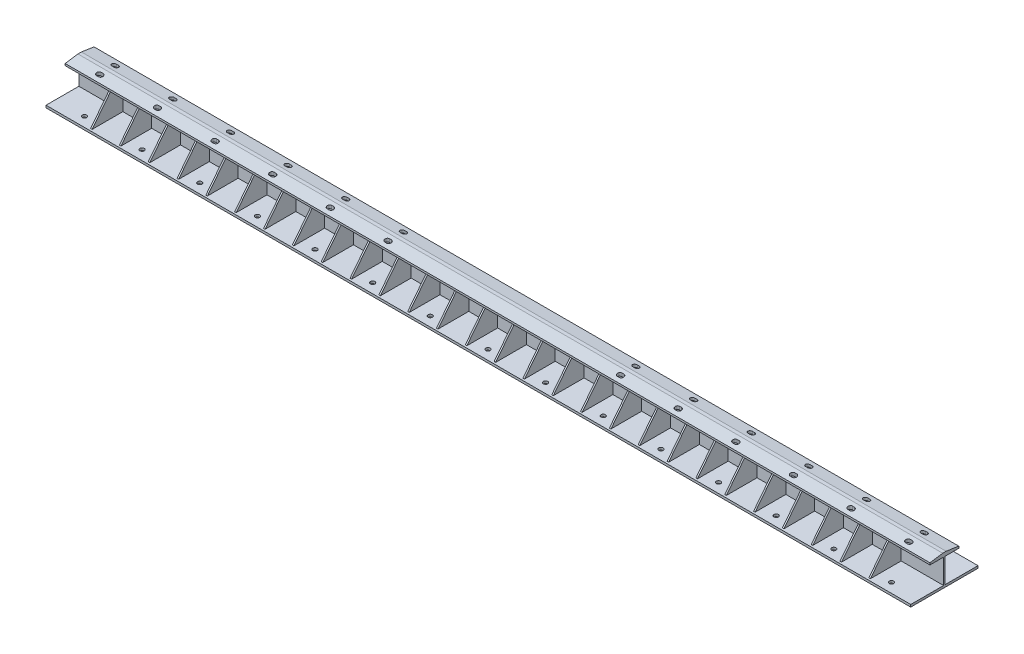
from build123d import *

# Parameters (mm, degrees)
SKETCH_1_W            = 4500
SKETCH_1_H            = 150
EXTRUDE_1_DEPTH       = 20
CUT_EXTRUDE_1_DEPTH   = 2252.338490765
SKETCH_2_W            = 8
SKETCH_2_H            = 128
SKETCH_2_W_2          = 4500
SKETCH_2_H_2          = 8
EXTRUDE_6_DEPTH       = 140
EXTRUDE_7_DEPTH       = 221
EXTRUDE_7_DEPTH_BACK  = 4279
SKETCH_6_W            = 350
SKETCH_6_H            = 12
CUT_EXTRUDE_2_DEPTH   = 4506.577099551
EXTRUDE_8_DEPTH       = 100
EXTRUDE_8_DEPTH_BACK  = 228
SKETCH_13_W           = 8
SKETCH_13_H           = 128
EXTRUDE_9_DEPTH       = 100
EXTRUDE_9_DEPTH_BACK  = 220
SKETCH_17_W           = 8
SKETCH_17_H           = 128
EXTRUDE_36_DEPTH      = 100
EXTRUDE_36_DEPTH_BACK = 228
SKETCH_17_2_W         = 8
SKETCH_17_2_H         = 128
EXTRUDE_10_DEPTH      = 100
EXTRUDE_10_DEPTH_BACK = 228
SKETCH_19_W           = 8
SKETCH_19_H           = 128
EXTRUDE_11_DEPTH      = 100
EXTRUDE_11_DEPTH_BACK = 228
SKETCH_20_W           = 8
SKETCH_20_H           = 128
EXTRUDE_12_DEPTH      = 100
EXTRUDE_12_DEPTH_BACK = 228
SKETCH_21_W           = 8
SKETCH_21_H           = 128
EXTRUDE_13_DEPTH      = 100
EXTRUDE_13_DEPTH_BACK = 228
SKETCH_23_W           = 8
SKETCH_23_H           = 128
EXTRUDE_14_DEPTH      = 100
EXTRUDE_14_DEPTH_BACK = 228
SKETCH_24_W           = 8
SKETCH_24_H           = 128
EXTRUDE_15_DEPTH      = 100
EXTRUDE_15_DEPTH_BACK = 228
SKETCH_25_W           = 8
SKETCH_25_H           = 128
EXTRUDE_16_DEPTH      = 100
EXTRUDE_16_DEPTH_BACK = 228
SKETCH_26_W           = 8
SKETCH_26_H           = 128
EXTRUDE_17_DEPTH      = 100
EXTRUDE_17_DEPTH_BACK = 228
SKETCH_27_W           = 8
SKETCH_27_H           = 128
EXTRUDE_18_DEPTH      = 100
EXTRUDE_18_DEPTH_BACK = 228
SKETCH_28_W           = 8
SKETCH_28_H           = 128
EXTRUDE_19_DEPTH      = 100
EXTRUDE_19_DEPTH_BACK = 228
SKETCH_29_W           = 8
SKETCH_29_H           = 128
EXTRUDE_20_DEPTH      = 100
EXTRUDE_20_DEPTH_BACK = 228
SKETCH_30_W           = 8
SKETCH_30_H           = 128
EXTRUDE_21_DEPTH      = 100
EXTRUDE_21_DEPTH_BACK = 228
SKETCH_31_W           = 8
SKETCH_31_H           = 128
EXTRUDE_22_DEPTH      = 100
EXTRUDE_22_DEPTH_BACK = 228
SKETCH_32_W           = 8
SKETCH_32_H           = 128
EXTRUDE_23_DEPTH      = 100
EXTRUDE_23_DEPTH_BACK = 228
SKETCH_33_W           = 8
SKETCH_33_H           = 128
EXTRUDE_24_DEPTH      = 100
EXTRUDE_24_DEPTH_BACK = 228
SKETCH_34_W           = 8
SKETCH_34_H           = 128
EXTRUDE_25_DEPTH      = 100
EXTRUDE_25_DEPTH_BACK = 228
SKETCH_35_W           = 8
SKETCH_35_H           = 128
EXTRUDE_26_DEPTH      = 100
EXTRUDE_26_DEPTH_BACK = 228
SKETCH_36_W           = 8
SKETCH_36_H           = 128
EXTRUDE_27_DEPTH      = 100
EXTRUDE_27_DEPTH_BACK = 228
SKETCH_37_W           = 8
SKETCH_37_H           = 128
EXTRUDE_28_DEPTH      = 100
EXTRUDE_28_DEPTH_BACK = 228
SKETCH_38_W           = 8
SKETCH_38_H           = 128
EXTRUDE_29_DEPTH      = 100
EXTRUDE_29_DEPTH_BACK = 228
SKETCH_39_W           = 8
SKETCH_39_H           = 128
EXTRUDE_30_DEPTH      = 100
EXTRUDE_30_DEPTH_BACK = 228
SKETCH_40_W           = 8
SKETCH_40_H           = 128
EXTRUDE_31_DEPTH      = 100
EXTRUDE_31_DEPTH_BACK = 228
SKETCH_41_W           = 8
SKETCH_41_H           = 128
EXTRUDE_32_DEPTH      = 100
EXTRUDE_32_DEPTH_BACK = 228
SKETCH_42_W           = 8
SKETCH_42_H           = 128
EXTRUDE_33_DEPTH      = 100
EXTRUDE_33_DEPTH_BACK = 228
SKETCH_43_W           = 8
SKETCH_43_H           = 128
EXTRUDE_34_DEPTH      = 100
EXTRUDE_34_DEPTH_BACK = 228
SKETCH_44_W           = 8
SKETCH_44_H           = 128
EXTRUDE_35_DEPTH      = 100
EXTRUDE_35_DEPTH_BACK = 228
SKETCH_45_W           = 8
SKETCH_45_H           = 128
CUT_EXTRUDE_3_DEPTH   = 4279
SKETCH_47_R           = 11.5
CUT_EXTRUDE_4_DEPTH   = 12
SKETCH_18_W           = 8
SKETCH_18_H           = 128
EXTRUDE_39_DEPTH      = 10


with BuildPart() as part:
    # 草图1 → 凸台-拉伸1 (new body)
    with BuildSketch(Plane(origin=(0, 0, 0), x_dir=(1, 0, 0), z_dir=(0, 1, 0))):
        Rectangle(SKETCH_1_W, SKETCH_1_H)
    extrude(amount=EXTRUDE_1_DEPTH)

    # 草图3 → 切除-拉伸1 (cut, through all)
    with BuildSketch(Plane.XZ):
        with BuildLine():
            Line((-610, 52), (-600, 52))
            ThreePointArc((-600, 52), (-588, 40), (-600, 28))
            Line((-600, 28), (-610, 28))
            ThreePointArc((-610, 28), (-622, 40), (-610, 52))
        make_face()
        with BuildLine():
            Line((-910, 52), (-900, 52))
            ThreePointArc((-900, 52), (-888, 40), (-900, 28))
            Line((-900, 28), (-910, 28))
            ThreePointArc((-910, 28), (-922, 40), (-910, 52))
        make_face()
        with BuildLine():
            Line((-1210, 52), (-1200, 52))
            ThreePointArc((-1200, 52), (-1188, 40), (-1200, 28))
            Line((-1200, 28), (-1210, 28))
            ThreePointArc((-1210, 28), (-1222, 40), (-1210, 52))
        make_face()
        with BuildLine():
            Line((-1510, 52), (-1500, 52))
            ThreePointArc((-1500, 52), (-1488, 40), (-1500, 28))
            Line((-1500, 28), (-1510, 28))
            ThreePointArc((-1510, 28), (-1522, 40), (-1510, 52))
        make_face()
        with BuildLine():
            Line((-1810, 52), (-1800, 52))
            ThreePointArc((-1800, 52), (-1788, 40), (-1800, 28))
            Line((-1800, 28), (-1810, 28))
            ThreePointArc((-1810, 28), (-1822, 40), (-1810, 52))
        make_face()
        with BuildLine():
            Line((-2110, 52), (-2100, 52))
            ThreePointArc((-2100, 52), (-2088, 40), (-2100, 28))
            Line((-2100, 28), (-2110, 28))
            ThreePointArc((-2110, 28), (-2122, 40), (-2110, 52))
        make_face()
        with BuildLine():
            Line((-2110, -28), (-2100, -28))
            ThreePointArc((-2100, -28), (-2088, -40), (-2100, -52))
            Line((-2100, -52), (-2110, -52))
            ThreePointArc((-2110, -52), (-2122, -40), (-2110, -28))
        make_face()
        with BuildLine():
            Line((-1810, -28), (-1800, -28))
            ThreePointArc((-1800, -28), (-1788, -40), (-1800, -52))
            Line((-1800, -52), (-1810, -52))
            ThreePointArc((-1810, -52), (-1822, -40), (-1810, -28))
        make_face()
        with BuildLine():
            Line((-1510, -28), (-1500, -28))
            ThreePointArc((-1500, -28), (-1488, -40), (-1500, -52))
            Line((-1500, -52), (-1510, -52))
            ThreePointArc((-1510, -52), (-1522, -40), (-1510, -28))
        make_face()
        with BuildLine():
            Line((-1210, -28), (-1200, -28))
            ThreePointArc((-1200, -28), (-1188, -40), (-1200, -52))
            Line((-1200, -52), (-1210, -52))
            ThreePointArc((-1210, -52), (-1222, -40), (-1210, -28))
        make_face()
        with BuildLine():
            Line((-910, -28), (-900, -28))
            ThreePointArc((-900, -28), (-888, -40), (-900, -52))
            Line((-900, -52), (-910, -52))
            ThreePointArc((-910, -52), (-922, -40), (-910, -28))
        make_face()
        with BuildLine():
            Line((600, -28), (610, -28))
            ThreePointArc((610, -28), (622, -40), (610, -52))
            Line((610, -52), (600, -52))
            ThreePointArc((600, -52), (588, -40), (600, -28))
        make_face()
        with BuildLine():
            Line((600, 52), (610, 52))
            ThreePointArc((610, 52), (622, 40), (610, 28))
            Line((610, 28), (600, 28))
            ThreePointArc((600, 28), (588, 40), (600, 52))
        make_face()
        with BuildLine():
            Line((-610, -28), (-600, -28))
            ThreePointArc((-600, -28), (-588, -40), (-600, -52))
            Line((-600, -52), (-610, -52))
            ThreePointArc((-610, -52), (-622, -40), (-610, -28))
        make_face()
        with BuildLine():
            Line((900, 52), (910, 52))
            ThreePointArc((910, 52), (922, 40), (910, 28))
            Line((910, 28), (900, 28))
            ThreePointArc((900, 28), (888, 40), (900, 52))
        make_face()
        with BuildLine():
            Line((900, -28), (910, -28))
            ThreePointArc((910, -28), (922, -40), (910, -52))
            Line((910, -52), (900, -52))
            ThreePointArc((900, -52), (888, -40), (900, -28))
        make_face()
        with BuildLine():
            Line((1200, 52), (1210, 52))
            ThreePointArc((1210, 52), (1222, 40), (1210, 28))
            Line((1210, 28), (1200, 28))
            ThreePointArc((1200, 28), (1188, 40), (1200, 52))
        make_face()
        with BuildLine():
            Line((1200, -28), (1210, -28))
            ThreePointArc((1210, -28), (1222, -40), (1210, -52))
            Line((1210, -52), (1200, -52))
            ThreePointArc((1200, -52), (1188, -40), (1200, -28))
        make_face()
        with BuildLine():
            Line((1500, 52), (1510, 52))
            ThreePointArc((1510, 52), (1522, 40), (1510, 28))
            Line((1510, 28), (1500, 28))
            ThreePointArc((1500, 28), (1488, 40), (1500, 52))
        make_face()
        with BuildLine():
            Line((1500, -28), (1510, -28))
            ThreePointArc((1510, -28), (1522, -40), (1510, -52))
            Line((1510, -52), (1500, -52))
            ThreePointArc((1500, -52), (1488, -40), (1500, -28))
        make_face()
        with BuildLine():
            Line((1800, 52), (1810, 52))
            ThreePointArc((1810, 52), (1822, 40), (1810, 28))
            Line((1810, 28), (1800, 28))
            ThreePointArc((1800, 28), (1788, 40), (1800, 52))
        make_face()
        with BuildLine():
            Line((1800, -28), (1810, -28))
            ThreePointArc((1810, -28), (1822, -40), (1810, -52))
            Line((1810, -52), (1800, -52))
            ThreePointArc((1800, -52), (1788, -40), (1800, -28))
        make_face()
        with BuildLine():
            Line((2100, 52), (2110, 52))
            ThreePointArc((2110, 52), (2122, 40), (2110, 28))
            Line((2110, 28), (2100, 28))
            ThreePointArc((2100, 28), (2088, 40), (2100, 52))
        make_face()
        with BuildLine():
            Line((2100, -28), (2110, -28))
            ThreePointArc((2110, -28), (2122, -40), (2110, -52))
            Line((2110, -52), (2100, -52))
            ThreePointArc((2100, -52), (2088, -40), (2100, -28))
        make_face()
    extrude(amount=-CUT_EXTRUDE_1_DEPTH, mode=Mode.SUBTRACT)

    # 草图2 → 凸台-拉伸6 (add)
    with BuildSketch(Plane.XZ):
        with Locations((225, 0)):
            Rectangle(SKETCH_2_W, SKETCH_2_H)
        Rectangle(SKETCH_2_W_2, SKETCH_2_H_2)
        with Locations((375, 0)):
            Rectangle(SKETCH_2_W, SKETCH_2_H)
        with Locations((525, 0)):
            Rectangle(SKETCH_2_W, SKETCH_2_H)
        with Locations((825, 0)):
            Rectangle(SKETCH_2_W, SKETCH_2_H)
        with Locations((975, 0)):
            Rectangle(SKETCH_2_W, SKETCH_2_H)
        with Locations((1125, 0)):
            Rectangle(SKETCH_2_W, SKETCH_2_H)
        with Locations((1275, 0)):
            Rectangle(SKETCH_2_W, SKETCH_2_H)
        with Locations((1575, 0)):
            Rectangle(SKETCH_2_W, SKETCH_2_H)
        with Locations((1725, 0)):
            Rectangle(SKETCH_2_W, SKETCH_2_H)
        with Locations((1875, 0)):
            Rectangle(SKETCH_2_W, SKETCH_2_H)
        with Locations((1425, 0)):
            Rectangle(SKETCH_2_W, SKETCH_2_H)
        with Locations((675, 0)):
            Rectangle(SKETCH_2_W, SKETCH_2_H)
        with Locations((2025, 0)):
            Rectangle(SKETCH_2_W, SKETCH_2_H)
        with Locations((-675, 0)):
            Rectangle(SKETCH_2_W, SKETCH_2_H)
        with Locations((-1425, 0)):
            Rectangle(SKETCH_2_W, SKETCH_2_H)
        with Locations((-1875, 0)):
            Rectangle(SKETCH_2_W, SKETCH_2_H)
        with Locations((-1725, 0)):
            Rectangle(SKETCH_2_W, SKETCH_2_H)
        with Locations((-1575, 0)):
            Rectangle(SKETCH_2_W, SKETCH_2_H)
        with Locations((-1275, 0)):
            Rectangle(SKETCH_2_W, SKETCH_2_H)
        with Locations((-1125, 0)):
            Rectangle(SKETCH_2_W, SKETCH_2_H)
        with Locations((-975, 0)):
            Rectangle(SKETCH_2_W, SKETCH_2_H)
        with Locations((-825, 0)):
            Rectangle(SKETCH_2_W, SKETCH_2_H)
        with Locations((-525, 0)):
            Rectangle(SKETCH_2_W, SKETCH_2_H)
        with Locations((-375, 0)):
            Rectangle(SKETCH_2_W, SKETCH_2_H)
        with Locations((-225, 0)):
            Rectangle(SKETCH_2_W, SKETCH_2_H)
        with Locations((75, 0)):
            Rectangle(SKETCH_2_W, SKETCH_2_H)
        with Locations((-75, 0)):
            Rectangle(SKETCH_2_W, SKETCH_2_H)
        with Locations((-2025, 0)):
            Rectangle(SKETCH_2_W, SKETCH_2_H)
    extrude(amount=EXTRUDE_6_DEPTH)

    # 草图6 → 凸台-拉伸7 (add, two sides: drawn at the far end of the back side and taken through both)
    with BuildSketch(Plane.ZY.offset(2029).offset(-EXTRUDE_7_DEPTH_BACK)):
        with Locations((0, -134)):
            Rectangle(SKETCH_6_W, SKETCH_6_H)
    extrude(amount=EXTRUDE_7_DEPTH + EXTRUDE_7_DEPTH_BACK)

    # 草图9 → 切除-拉伸2 (cut, through all)
    with BuildSketch(Plane(origin=(2250, 0, 0), x_dir=(0, 0, -1), z_dir=(1, 0, 0))):
        Polygon((-75, 10), (-9, 20), (-75, 20), align=None)
        Polygon((75, 10), (9, 20), (75, 20), align=None)
    extrude(amount=-CUT_EXTRUDE_2_DEPTH, mode=Mode.SUBTRACT)

    # 草图13 → 凸台-拉伸8 (add, two sides: drawn at the far end of the back side and taken through both)
    with BuildSketch(Plane.XY.offset(64).offset(-EXTRUDE_8_DEPTH_BACK)):
        with Locations((2025, -64)):
            Rectangle(SKETCH_13_W, SKETCH_13_H)
    extrude(amount=EXTRUDE_8_DEPTH + EXTRUDE_8_DEPTH_BACK)

    # 草图17 → 凸台-拉伸9 (add, two sides: drawn at the far end of the back side and taken through both)
    with BuildSketch(Plane.XY.offset(64).offset(-EXTRUDE_9_DEPTH_BACK)):
        with Locations((1875, -64)):
            Rectangle(SKETCH_17_W, SKETCH_17_H)
    extrude(amount=EXTRUDE_9_DEPTH + EXTRUDE_9_DEPTH_BACK)

    # 草图17<2> → 凸台-拉伸36 (add, two sides: drawn at the far end of the back side and taken through both)
    with BuildSketch(Plane.XY.offset(64).offset(-EXTRUDE_36_DEPTH_BACK)):
        with Locations((1875, -64)):
            Rectangle(SKETCH_17_2_W, SKETCH_17_2_H)
    extrude(amount=EXTRUDE_36_DEPTH + EXTRUDE_36_DEPTH_BACK)

    # 草图19 → 凸台-拉伸10 (add, two sides: drawn at the far end of the back side and taken through both)
    with BuildSketch(Plane(origin=(0, 0, -64), x_dir=(-1, 0, 0), z_dir=(0, 0, -1)).offset(-EXTRUDE_10_DEPTH_BACK)):
        with Locations((-1725, -64)):
            Rectangle(SKETCH_19_W, SKETCH_19_H)
    extrude(amount=EXTRUDE_10_DEPTH + EXTRUDE_10_DEPTH_BACK)

    # 草图20 → 凸台-拉伸11 (add, two sides: drawn at the far end of the back side and taken through both)
    with BuildSketch(Plane(origin=(0, 0, -64), x_dir=(-1, 0, 0), z_dir=(0, 0, -1)).offset(-EXTRUDE_11_DEPTH_BACK)):
        with Locations((-1575, -64)):
            Rectangle(SKETCH_20_W, SKETCH_20_H)
    extrude(amount=EXTRUDE_11_DEPTH + EXTRUDE_11_DEPTH_BACK)

    # 草图21 → 凸台-拉伸12 (add, two sides: drawn at the far end of the back side and taken through both)
    with BuildSketch(Plane(origin=(0, 0, -64), x_dir=(-1, 0, 0), z_dir=(0, 0, -1)).offset(-EXTRUDE_12_DEPTH_BACK)):
        with Locations((-1425, -64)):
            Rectangle(SKETCH_21_W, SKETCH_21_H)
    extrude(amount=EXTRUDE_12_DEPTH + EXTRUDE_12_DEPTH_BACK)

    # 草图23 → 凸台-拉伸13 (add, two sides: drawn at the far end of the back side and taken through both)
    with BuildSketch(Plane(origin=(0, 0, -64), x_dir=(-1, 0, 0), z_dir=(0, 0, -1)).offset(-EXTRUDE_13_DEPTH_BACK)):
        with Locations((-1275, -64)):
            Rectangle(SKETCH_23_W, SKETCH_23_H)
    extrude(amount=EXTRUDE_13_DEPTH + EXTRUDE_13_DEPTH_BACK)

    # 草图24 → 凸台-拉伸14 (add, two sides: drawn at the far end of the back side and taken through both)
    with BuildSketch(Plane(origin=(0, 0, -64), x_dir=(-1, 0, 0), z_dir=(0, 0, -1)).offset(-EXTRUDE_14_DEPTH_BACK)):
        with Locations((-1125, -64)):
            Rectangle(SKETCH_24_W, SKETCH_24_H)
    extrude(amount=EXTRUDE_14_DEPTH + EXTRUDE_14_DEPTH_BACK)

    # 草图25 → 凸台-拉伸15 (add, two sides: drawn at the far end of the back side and taken through both)
    with BuildSketch(Plane(origin=(0, 0, -64), x_dir=(-1, 0, 0), z_dir=(0, 0, -1)).offset(-EXTRUDE_15_DEPTH_BACK)):
        with Locations((-975, -64)):
            Rectangle(SKETCH_25_W, SKETCH_25_H)
    extrude(amount=EXTRUDE_15_DEPTH + EXTRUDE_15_DEPTH_BACK)

    # 草图26 → 凸台-拉伸16 (add, two sides: drawn at the far end of the back side and taken through both)
    with BuildSketch(Plane(origin=(0, 0, -64), x_dir=(-1, 0, 0), z_dir=(0, 0, -1)).offset(-EXTRUDE_16_DEPTH_BACK)):
        with Locations((-825, -64)):
            Rectangle(SKETCH_26_W, SKETCH_26_H)
    extrude(amount=EXTRUDE_16_DEPTH + EXTRUDE_16_DEPTH_BACK)

    # 草图27 → 凸台-拉伸17 (add, two sides: drawn at the far end of the back side and taken through both)
    with BuildSketch(Plane(origin=(0, 0, -64), x_dir=(-1, 0, 0), z_dir=(0, 0, -1)).offset(-EXTRUDE_17_DEPTH_BACK)):
        with Locations((-675, -64)):
            Rectangle(SKETCH_27_W, SKETCH_27_H)
    extrude(amount=EXTRUDE_17_DEPTH + EXTRUDE_17_DEPTH_BACK)

    # 草图28 → 凸台-拉伸18 (add, two sides: drawn at the far end of the back side and taken through both)
    with BuildSketch(Plane(origin=(0, 0, -64), x_dir=(-1, 0, 0), z_dir=(0, 0, -1)).offset(-EXTRUDE_18_DEPTH_BACK)):
        with Locations((-525, -64)):
            Rectangle(SKETCH_28_W, SKETCH_28_H)
    extrude(amount=EXTRUDE_18_DEPTH + EXTRUDE_18_DEPTH_BACK)

    # 草图29 → 凸台-拉伸19 (add, two sides: drawn at the far end of the back side and taken through both)
    with BuildSketch(Plane(origin=(0, 0, -64), x_dir=(-1, 0, 0), z_dir=(0, 0, -1)).offset(-EXTRUDE_19_DEPTH_BACK)):
        with Locations((-375, -64)):
            Rectangle(SKETCH_29_W, SKETCH_29_H)
    extrude(amount=EXTRUDE_19_DEPTH + EXTRUDE_19_DEPTH_BACK)

    # 草图30 → 凸台-拉伸20 (add, two sides: drawn at the far end of the back side and taken through both)
    with BuildSketch(Plane(origin=(0, 0, -64), x_dir=(-1, 0, 0), z_dir=(0, 0, -1)).offset(-EXTRUDE_20_DEPTH_BACK)):
        with Locations((-225, -64)):
            Rectangle(SKETCH_30_W, SKETCH_30_H)
    extrude(amount=EXTRUDE_20_DEPTH + EXTRUDE_20_DEPTH_BACK)

    # 草图31 → 凸台-拉伸21 (add, two sides: drawn at the far end of the back side and taken through both)
    with BuildSketch(Plane(origin=(0, 0, -64), x_dir=(-1, 0, 0), z_dir=(0, 0, -1)).offset(-EXTRUDE_21_DEPTH_BACK)):
        with Locations((-75, -64)):
            Rectangle(SKETCH_31_W, SKETCH_31_H)
    extrude(amount=EXTRUDE_21_DEPTH + EXTRUDE_21_DEPTH_BACK)

    # 草图32 → 凸台-拉伸22 (add, two sides: drawn at the far end of the back side and taken through both)
    with BuildSketch(Plane(origin=(0, 0, -64), x_dir=(-1, 0, 0), z_dir=(0, 0, -1)).offset(-EXTRUDE_22_DEPTH_BACK)):
        with Locations((75, -64)):
            Rectangle(SKETCH_32_W, SKETCH_32_H)
    extrude(amount=EXTRUDE_22_DEPTH + EXTRUDE_22_DEPTH_BACK)

    # 草图33 → 凸台-拉伸23 (add, two sides: drawn at the far end of the back side and taken through both)
    with BuildSketch(Plane(origin=(0, 0, -64), x_dir=(-1, 0, 0), z_dir=(0, 0, -1)).offset(-EXTRUDE_23_DEPTH_BACK)):
        with Locations((225, -64)):
            Rectangle(SKETCH_33_W, SKETCH_33_H)
    extrude(amount=EXTRUDE_23_DEPTH + EXTRUDE_23_DEPTH_BACK)

    # 草图34 → 凸台-拉伸24 (add, two sides: drawn at the far end of the back side and taken through both)
    with BuildSketch(Plane(origin=(0, 0, -64), x_dir=(-1, 0, 0), z_dir=(0, 0, -1)).offset(-EXTRUDE_24_DEPTH_BACK)):
        with Locations((375, -64)):
            Rectangle(SKETCH_34_W, SKETCH_34_H)
    extrude(amount=EXTRUDE_24_DEPTH + EXTRUDE_24_DEPTH_BACK)

    # 草图35 → 凸台-拉伸25 (add, two sides: drawn at the far end of the back side and taken through both)
    with BuildSketch(Plane(origin=(0, 0, -64), x_dir=(-1, 0, 0), z_dir=(0, 0, -1)).offset(-EXTRUDE_25_DEPTH_BACK)):
        with Locations((525, -64)):
            Rectangle(SKETCH_35_W, SKETCH_35_H)
    extrude(amount=EXTRUDE_25_DEPTH + EXTRUDE_25_DEPTH_BACK)

    # 草图36 → 凸台-拉伸26 (add, two sides: drawn at the far end of the back side and taken through both)
    with BuildSketch(Plane(origin=(0, 0, -64), x_dir=(-1, 0, 0), z_dir=(0, 0, -1)).offset(-EXTRUDE_26_DEPTH_BACK)):
        with Locations((675, -64)):
            Rectangle(SKETCH_36_W, SKETCH_36_H)
    extrude(amount=EXTRUDE_26_DEPTH + EXTRUDE_26_DEPTH_BACK)

    # 草图37 → 凸台-拉伸27 (add, two sides: drawn at the far end of the back side and taken through both)
    with BuildSketch(Plane(origin=(0, 0, -64), x_dir=(-1, 0, 0), z_dir=(0, 0, -1)).offset(-EXTRUDE_27_DEPTH_BACK)):
        with Locations((825, -64)):
            Rectangle(SKETCH_37_W, SKETCH_37_H)
    extrude(amount=EXTRUDE_27_DEPTH + EXTRUDE_27_DEPTH_BACK)

    # 草图38 → 凸台-拉伸28 (add, two sides: drawn at the far end of the back side and taken through both)
    with BuildSketch(Plane(origin=(0, 0, -64), x_dir=(-1, 0, 0), z_dir=(0, 0, -1)).offset(-EXTRUDE_28_DEPTH_BACK)):
        with Locations((975, -64)):
            Rectangle(SKETCH_38_W, SKETCH_38_H)
    extrude(amount=EXTRUDE_28_DEPTH + EXTRUDE_28_DEPTH_BACK)

    # 草图39 → 凸台-拉伸29 (add, two sides: drawn at the far end of the back side and taken through both)
    with BuildSketch(Plane(origin=(0, 0, -64), x_dir=(-1, 0, 0), z_dir=(0, 0, -1)).offset(-EXTRUDE_29_DEPTH_BACK)):
        with Locations((1125, -64)):
            Rectangle(SKETCH_39_W, SKETCH_39_H)
    extrude(amount=EXTRUDE_29_DEPTH + EXTRUDE_29_DEPTH_BACK)

    # 草图40 → 凸台-拉伸30 (add, two sides: drawn at the far end of the back side and taken through both)
    with BuildSketch(Plane(origin=(0, 0, -64), x_dir=(-1, 0, 0), z_dir=(0, 0, -1)).offset(-EXTRUDE_30_DEPTH_BACK)):
        with Locations((1275, -64)):
            Rectangle(SKETCH_40_W, SKETCH_40_H)
    extrude(amount=EXTRUDE_30_DEPTH + EXTRUDE_30_DEPTH_BACK)

    # 草图41 → 凸台-拉伸31 (add, two sides: drawn at the far end of the back side and taken through both)
    with BuildSketch(Plane(origin=(0, 0, -64), x_dir=(-1, 0, 0), z_dir=(0, 0, -1)).offset(-EXTRUDE_31_DEPTH_BACK)):
        with Locations((1425, -64)):
            Rectangle(SKETCH_41_W, SKETCH_41_H)
    extrude(amount=EXTRUDE_31_DEPTH + EXTRUDE_31_DEPTH_BACK)

    # 草图42 → 凸台-拉伸32 (add, two sides: drawn at the far end of the back side and taken through both)
    with BuildSketch(Plane(origin=(0, 0, -64), x_dir=(-1, 0, 0), z_dir=(0, 0, -1)).offset(-EXTRUDE_32_DEPTH_BACK)):
        with Locations((1575, -64)):
            Rectangle(SKETCH_42_W, SKETCH_42_H)
    extrude(amount=EXTRUDE_32_DEPTH + EXTRUDE_32_DEPTH_BACK)

    # 草图43 → 凸台-拉伸33 (add, two sides: drawn at the far end of the back side and taken through both)
    with BuildSketch(Plane(origin=(0, 0, -64), x_dir=(-1, 0, 0), z_dir=(0, 0, -1)).offset(-EXTRUDE_33_DEPTH_BACK)):
        with Locations((1725, -64)):
            Rectangle(SKETCH_43_W, SKETCH_43_H)
    extrude(amount=EXTRUDE_33_DEPTH + EXTRUDE_33_DEPTH_BACK)

    # 草图44 → 凸台-拉伸34 (add, two sides: drawn at the far end of the back side and taken through both)
    with BuildSketch(Plane(origin=(0, 0, -64), x_dir=(-1, 0, 0), z_dir=(0, 0, -1)).offset(-EXTRUDE_34_DEPTH_BACK)):
        with Locations((1875, -64)):
            Rectangle(SKETCH_44_W, SKETCH_44_H)
    extrude(amount=EXTRUDE_34_DEPTH + EXTRUDE_34_DEPTH_BACK)

    # 草图45 → 凸台-拉伸35 (add, two sides: drawn at the far end of the back side and taken through both)
    with BuildSketch(Plane(origin=(0, 0, -64), x_dir=(-1, 0, 0), z_dir=(0, 0, -1)).offset(-EXTRUDE_35_DEPTH_BACK)):
        with Locations((2025, -64)):
            Rectangle(SKETCH_45_W, SKETCH_45_H)
    extrude(amount=EXTRUDE_35_DEPTH + EXTRUDE_35_DEPTH_BACK)

    # 草图46 → 切除-拉伸3 (cut)
    with BuildSketch(Plane(origin=(2029, 0, 0), x_dir=(0, 0, -1), z_dir=(1, 0, 0))):
        Polygon((64, 0), (164, -128), (164, 0), align=None)
        Polygon((-64, 0), (-164, -128), (-164, 0), align=None)
    extrude(amount=-CUT_EXTRUDE_3_DEPTH, mode=Mode.SUBTRACT)

    # 草图47 → 切除-拉伸4 (cut)
    with BuildSketch(Plane.XZ.offset(140)):
        with Locations((0, 125)):
            Circle(SKETCH_47_R)
        with Locations((300, 125)):
            Circle(SKETCH_47_R)
        with Locations((600, 125)):
            Circle(SKETCH_47_R)
        with Locations((900, 125)):
            Circle(SKETCH_47_R)
        with Locations((1200, 125)):
            Circle(SKETCH_47_R)
        with Locations((2100, 125)):
            Circle(SKETCH_47_R)
        with Locations((1800, 125)):
            Circle(SKETCH_47_R)
        with Locations((1500, 125)):
            Circle(SKETCH_47_R)
        with Locations((0, -125)):
            Circle(SKETCH_47_R)
        with Locations((300, -125)):
            Circle(SKETCH_47_R)
        with Locations((600, -125)):
            Circle(SKETCH_47_R)
        with Locations((900, -125)):
            Circle(SKETCH_47_R)
        with Locations((1200, -125)):
            Circle(SKETCH_47_R)
        with Locations((1500, -125)):
            Circle(SKETCH_47_R)
        with Locations((1800, -125)):
            Circle(SKETCH_47_R)
        with Locations((2100, -125)):
            Circle(SKETCH_47_R)
        with Locations((-300, 125)):
            Circle(SKETCH_47_R)
        with Locations((-600, 125)):
            Circle(SKETCH_47_R)
        with Locations((-900, 125)):
            Circle(SKETCH_47_R)
        with Locations((-1200, 125)):
            Circle(SKETCH_47_R)
        with Locations((-1500, 125)):
            Circle(SKETCH_47_R)
        with Locations((-1800, 125)):
            Circle(SKETCH_47_R)
        with Locations((-600, -125)):
            Circle(SKETCH_47_R)
        with Locations((-300, -125)):
            Circle(SKETCH_47_R)
        with Locations((-900, -125)):
            Circle(SKETCH_47_R)
        with Locations((-2100, -125)):
            Circle(SKETCH_47_R)
        with Locations((-1800, -125)):
            Circle(SKETCH_47_R)
        with Locations((-1500, -125)):
            Circle(SKETCH_47_R)
        with Locations((-1200, -125)):
            Circle(SKETCH_47_R)
        with Locations((-2100, 125)):
            Circle(SKETCH_47_R)
    extrude(amount=-CUT_EXTRUDE_4_DEPTH, mode=Mode.SUBTRACT)

    # 草图18 → 凸台-拉伸39 (add)
    with BuildSketch(Plane(origin=(0, 0, -64), x_dir=(-1, 0, 0), z_dir=(0, 0, -1))):
        with Locations((-1725, -64)):
            Rectangle(SKETCH_18_W, SKETCH_18_H)
    extrude(amount=-EXTRUDE_39_DEPTH)


solid = part.part
